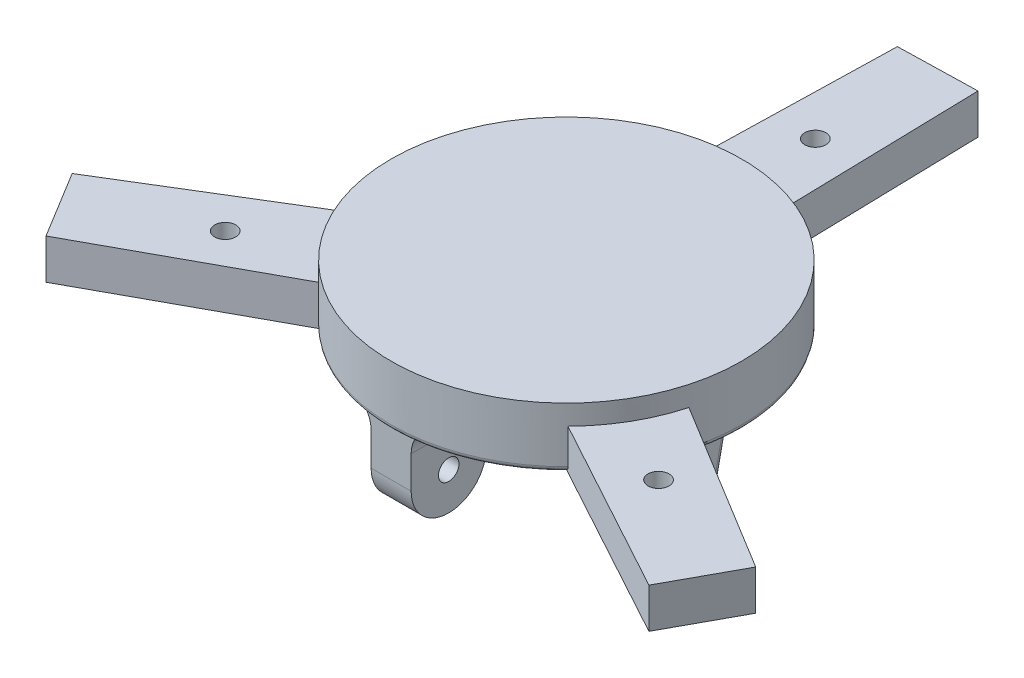
from build123d import *
from build123d.topology import SkipClean

# Parameters (mm, degrees)
SKETCH1_R               = 35
BOSS_EXTRUDE1_DEPTH     = 12
BOSS_EXTRUDE2_DEPTH     = 8
SKETCH3_R               = 2.1
CUT_EXTRUDE1_DEPTH      = 102.700236702
CUT_EXTRUDE2_DEPTH      = 4
SKETCH5_W               = 45
SKETCH5_H               = 50
BOSS_EXTRUDE3_DEPTH     = 28
SKETCH6_OUTSIDE_W       = 157.331
SKETCH6_OUTSIDE_H       = 78.982
CUT_EXTRUDE6_DEPTH      = 45
CUT_EXTRUDE7_DEPTH      = 183.4909262
CUT_EXTRUDE7_DEPTH_BACK = 183.4909262
SKETCH7_W               = 30
SKETCH7_H               = 28
CUT_EXTRUDE8_DEPTH      = 192.897469384
CUT_EXTRUDE8_DEPTH_BACK = 192.897469384
SKETCH8_R               = 2.5
FILLET1_R               = 1
FILLET2_R               = 1
SKETCH11_W              = 15
SKETCH11_H              = 20
BOSS_EXTRUDE4_DEPTH     = 8
FILLET3_RADIUS          = 7.5
FILLET3_LENGTH          = 8
FILLET4_RADIUS          = 7.5
FILLET4_LENGTH          = 8
FILLET5_R               = 10
FILLET6_START           = 5.9999999
FILLET6_DEPTH           = 25.0000001
FILLET6_START_2         = -31
FILLET6_2_DEPTH         = 25
FILLET6_START_3         = -15
FILLET6_3_DEPTH         = 22
SKETCH12_R              = 2.05
CUT_EXTRUDE9_DEPTH      = 8


with BuildPart() as part:
    # Sketch1 → Boss-Extrude1 (new body)
    with BuildSketch(Plane.XZ.offset(112)):
        Circle(SKETCH1_R)
    extrude(amount=BOSS_EXTRUDE1_DEPTH)

    # Sketch2 → Boss-Extrude2 (add)
    with BuildSketch(Plane.XZ.offset(116)):
        with BuildLine():
            Line((-8.843514051, -33.864321331), (-7.865061208, -73.980887907))
            Line((-7.865061208, -73.980887907), (7.855709173, -74.364321331))
            Line((7.855709173, -74.364321331), (8.843514051, -33.864321331))
            ThreePointArc((8.843514051, -33.864321331), (0, -35), (-8.843514051, -33.864321331))
        make_face()
        with BuildLine():
            Line((-68.329245995, 30.378916957), (-33.74911958, 9.273452839))
            ThreePointArc((-33.74911958, 9.273452839), (-30.310889132, 17.5), (-24.905605529, 24.590868492))
            Line((-24.905605529, 24.590868492), (-60.136797719, 43.801786762))
            Line((-60.136797719, 43.801786762), (-68.329245995, 30.378916957))
        make_face()
        with BuildLine():
            Line((60.473536822, 43.985404374), (24.905605529, 24.590868492))
            ThreePointArc((24.905605529, 24.590868492), (30.310889132, 17.5), (33.74911958, 9.273452839))
            Line((33.74911958, 9.273452839), (68.001858926, 30.179101146))
            Line((68.001858926, 30.179101146), (60.473536822, 43.985404374))
        make_face()
    extrude(amount=BOSS_EXTRUDE2_DEPTH)

    # Sketch3 → Cut-Extrude1 (cut, through all)
    with BuildSketch(Plane.XZ.offset(124)):
        with Locations((-0.12195122, -49.851336501)):
            Circle(SKETCH3_R)
        with Locations((43.233499432, 24.820055396)):
            Circle(SKETCH3_R)
        with Locations((-43.111548213, 25.031281105)):
            Circle(SKETCH3_R)
    extrude(amount=-CUT_EXTRUDE1_DEPTH, mode=Mode.SUBTRACT)

    # Sketch4 → Cut-Extrude2 (cut)
    with BuildSketch(Plane.XZ.offset(124)):
        Polygon((4.612320988, -49.851336501), (2.245184884, -45.751336501), (-2.489087323, -45.751336501), (-4.856223427, -49.851336501), (-2.489087323, -53.951336501), (2.245184884, -53.951336501), align=None)
        Polygon((47.967771639, 24.820055396), (45.600635536, 28.920055396), (40.866363328, 28.920055396), (38.499227225, 24.820055396), (40.866363328, 20.720055396), (45.600635536, 20.720055396), align=None)
        Polygon((-38.377276005, 25.031281105), (-40.744412109, 29.131281105), (-45.478684316, 29.131281105), (-47.84582042, 25.031281105), (-45.478684316, 20.931281105), (-40.744412109, 20.931281105), align=None)
    extrude(amount=-CUT_EXTRUDE2_DEPTH, mode=Mode.SUBTRACT)

    # Sketch5 → Boss-Extrude3 (add)
    with BuildSketch(Plane.XZ.offset(124)):
        Rectangle(SKETCH5_W, SKETCH5_H)
    extrude(amount=BOSS_EXTRUDE3_DEPTH)

    # Sketch6 outside → Cut-Extrude6 (cut)
    with BuildSketch(Plane.ZY.offset(22.5)):
        with Locations((-15.1895, -132)):
            Rectangle(SKETCH6_OUTSIDE_W, SKETCH6_OUTSIDE_H)
        with BuildLine():
            Line((-7.337791774, -146.051390307), (-12, -124))
            Line((-12, -124), (-100, -124))
            Line((-100, -124), (-100, -74))
            Line((-100, -74), (100, -74))
            Line((100, -74), (100, -124))
            Line((100, -124), (12, -124))
            Line((12, -124), (7.337791774, -146.051390307))
            ThreePointArc((7.337791774, -146.051390307), (0, -152), (-7.337791774, -146.051390307))
        make_face(mode=Mode.SUBTRACT)
    extrude(amount=-CUT_EXTRUDE6_DEPTH, mode=Mode.SUBTRACT)

    # Sketch7 → Cut-Extrude7 (cut, two sides: drawn at the far end of the back side and taken through both)
    with BuildSketch(Plane.XY.offset(-CUT_EXTRUDE7_DEPTH_BACK)):
        with Locations((0, -138)):
            Rectangle(SKETCH7_W, SKETCH7_H)
    extrude(amount=CUT_EXTRUDE7_DEPTH + CUT_EXTRUDE7_DEPTH_BACK, mode=Mode.SUBTRACT)

    # Sketch8 → Cut-Extrude8 (cut, two sides: drawn at the far end of the back side and taken through both)
    with BuildSketch(Plane.ZY.offset(22.5).offset(-CUT_EXTRUDE8_DEPTH_BACK)):
        with Locations(Location((0, -144.5, 0), (0, 0, 270))):
            Circle(SKETCH8_R)
    extrude(amount=CUT_EXTRUDE8_DEPTH + CUT_EXTRUDE8_DEPTH_BACK, mode=Mode.SUBTRACT)

    # Fillet1
    fillet1_edges = [part.edges().sort_by_distance(p)[0] for p in [
        (22.5, -152, 0),
        (-22.5, -152, 0),
        (22.5, -135.025695153, -9.668895887),
        (-22.5, -135.025695153, -9.668895887),
        (22.5, -135.025695153, 9.668895887),
        (-22.5, -135.025695153, 9.668895887),
        (15, -135.025695153, 9.668895887),
        (-15, -135.025695153, 9.668895887),
        (-15, -152, 0),
        (-15, -135.025695153, -9.668895887),
        (15, -135.025695153, -9.668895887),
        (15, -152, 0),
    ]]
    fillet(fillet1_edges, radius=FILLET1_R)

    # Fillet2
    fillet2_edges = [part.edges().sort_by_distance(p)[0] for p in [
        (-30.310889132, -124, -17.5),
        (0, -124, 35),
        (27.699485481, -124, -21.394824236),
    ]]
    fillet(fillet2_edges, radius=FILLET2_R)

    # Sketch11 → Boss-Extrude4 (add)
    with BuildSketch(Plane(origin=(0, 0, 0), x_dir=(0, 0, -1), z_dir=(1, 0, 0))):
        with Locations((-23.5, -134)):
            Rectangle(SKETCH11_W, SKETCH11_H)
        with Locations((23.5, -134)):
            Rectangle(SKETCH11_W, SKETCH11_H)
    extrude(amount=-BOSS_EXTRUDE4_DEPTH)

    # Fillet3: full round fillet: the end face becomes a half cylinder, R = half its width
    fillet3_face = Plane((-4, -144, -23.5), x_dir=(-1, 0, 0), z_dir=(0, -1, 0))  # on the end face: x along it, z out of the body
    fillet3_slab = fillet3_face.offset(-FILLET3_RADIUS / 2) * Box(FILLET3_LENGTH, 2 * FILLET3_RADIUS, FILLET3_RADIUS, mode=Mode.PRIVATE)  # the body's end, R deep
    fillet3_round = Plane((-4, -136.5, -23.5), x_dir=(0, -1, 0), z_dir=(-1, 0, 0)) * Cylinder(FILLET3_RADIUS, FILLET3_LENGTH, mode=Mode.PRIVATE)  # its axis R under the face
    add(fillet3_slab - fillet3_round, mode=Mode.SUBTRACT)

    # Fillet4: full round fillet: the end face becomes a half cylinder, R = half its width
    fillet4_face = Plane((-4, -144, 23.5), x_dir=(-1, 0, 0), z_dir=(0, -1, 0))  # on the end face: x along it, z out of the body
    fillet4_slab = fillet4_face.offset(-FILLET4_RADIUS / 2) * Box(FILLET4_LENGTH, 2 * FILLET4_RADIUS, FILLET4_RADIUS, mode=Mode.PRIVATE)  # the body's end, R deep
    fillet4_round = Plane((-4, -136.5, 23.5), x_dir=(0, -1, 0), z_dir=(-1, 0, 0)) * Cylinder(FILLET4_RADIUS, FILLET4_LENGTH, mode=Mode.PRIVATE)  # its axis R under the face
    add(fillet4_slab - fillet4_round, mode=Mode.SUBTRACT)

    # Fillet5
    fillet5_edges = [part.edges().sort_by_distance(p)[0] for p in [
        (-4, -124, 16),
        (-4, -124, -16),
    ]]
    fillet(fillet5_edges, radius=FILLET5_R)

    # Fillet6: read off the stored shape, not the designer's step
    # Fillet6 outline → Fillet6 (add)
    with BuildSketch(Plane.XY.offset(FILLET6_START)):
        with BuildLine():
            Line((0, -124), (0, -130))
            ThreePointArc((0, -130), (1.757359313, -125.757359313), (6, -124))
            Line((6, -124), (0, -124))
        make_face()
        with BuildLine():
            Line((-8, -130), (-8, -124))
            Line((-8, -124), (-14, -124))
            ThreePointArc((-14, -124), (-9.757359313, -125.757359313), (-8, -130))
        make_face()
    extrude(amount=FILLET6_DEPTH)

    # Fillet6 2 outline → Fillet6 2 (add)
    with BuildSketch(Plane.XY.offset(FILLET6_START_2)):
        with BuildLine():
            Line((0, -124), (0, -130))
            ThreePointArc((0, -130), (1.757359313, -125.757359313), (6, -124))
            Line((6, -124), (0, -124))
        make_face()
        with BuildLine():
            Line((-8, -130), (-8, -124))
            Line((-8, -124), (-14, -124))
            ThreePointArc((-14, -124), (-9.757359313, -125.757359313), (-8, -130))
        make_face()
    extrude(amount=FILLET6_2_DEPTH)

    # Fillet6 3 outline → Fillet6 3 (cut)
    with SkipClean():  # the faces are left unmerged after this step: merging them gives an invalid solid
        with BuildSketch(Plane.YZ.offset(FILLET6_START_3)):
            with BuildLine():
                Line((-130, 15.16515139), (-130, 5.9999999))
                Line((-130, 5.9999999), (-124, 6))
                ThreePointArc((-124, 6), (-125.633399735, 11.477225575), (-130, 15.16515139))
            make_face()
            with BuildLine():
                Line((-130, -6), (-130, -15.16515139))
                ThreePointArc((-130, -15.16515139), (-125.633399735, -11.477225575), (-124, -6))
                Line((-124, -6), (-130, -6))
            make_face()
        extrude(amount=FILLET6_3_DEPTH, mode=Mode.SUBTRACT)
    add(part.part.scale(1), mode=Mode.REPLACE)  # the faces are merged on a copy

    # Sketch12 → Cut-Extrude9 (cut)
    with BuildSketch(Plane.ZY.offset(8)):
        with Locations((-23.5, -136.5)):
            Circle(SKETCH12_R)
        with Locations((23.5, -136.5)):
            Circle(SKETCH12_R)
    extrude(amount=-CUT_EXTRUDE9_DEPTH, mode=Mode.SUBTRACT)


solid = part.part
